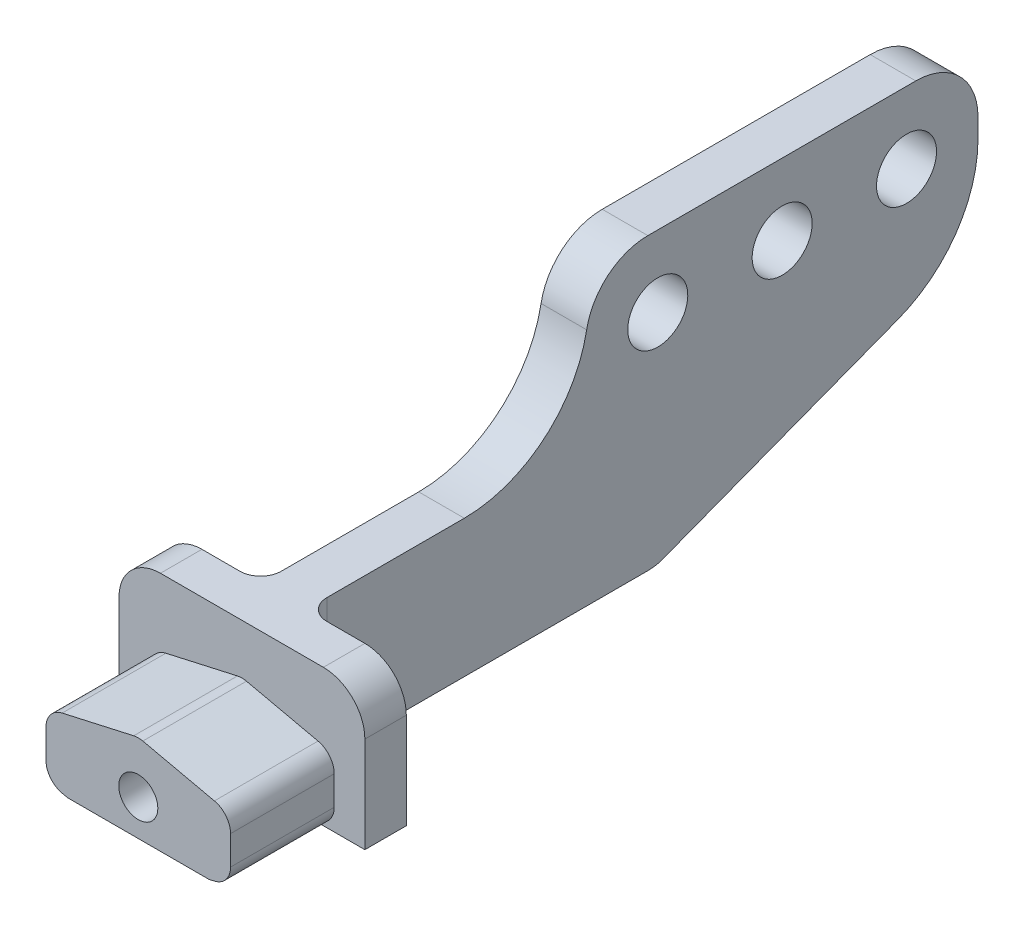
from build123d import *

# Parameters (mm, degrees)
SKETCH3_W                      = 5.93
SKETCH3_H                      = 4.886
MOUNT_BASE_PLATE_DEPTH         = 1
HORN_LEVER_PROFILE_W           = 1.1
HORN_LEVER_PROFILE_H           = 7
LEVER_PROFILE_DEPTH            = 16.204
LOWER_CH_FRONT_DIVOT_W         = 6.814
LOWER_CH_FRONT_DIVOT_H         = 3.69
FRONT_BASE_PROFILE_CUT_DEPTH   = 19.667421273
REAR_PROFILE_CUT_DEPTH         = 19.667421273
F_3_HOLES_R                    = 0.7239
F_3_HOLES_CIUT_DEPTH           = 19.667421273
THRU_BASE_MOUNT_TAB_DEPTH      = 2.5
SKETCH9_R                      = 0.47117
THRU_BASE_MOUNT_TAB_HOLE_DEPTH = 4
BASE_PLATE_CORNER_FILLET_R     = 1
FRONT_LEVER_UNDER_FILLET_R     = 3
FRONT_LEVER_TOP_FILLETS_R      = 1.5
REAR_TOP_FILLET_R              = 3
SIDE_BASE_LEVER_ARM_FILLETS_R  = 0.5
THRU_BASE_MOUNT_TAB_FILLETS_R  = 0.5
BOT_MIIDLEVER_ANGLE_FILLET_R   = 1


with BuildPart() as part:
    # Sketch3 → Mount Base Plate (new body)
    with BuildSketch(Plane.XY):
        with Locations((0, 2.443)):
            Rectangle(SKETCH3_W, SKETCH3_H)
    extrude(amount=MOUNT_BASE_PLATE_DEPTH)

    # Horn Lever Profile → Lever Profile (add)
    with BuildSketch(Plane.XY):
        with Locations((0, 5.076)):
            Rectangle(HORN_LEVER_PROFILE_W, HORN_LEVER_PROFILE_H)
    extrude(amount=-LEVER_PROFILE_DEPTH)

    # Lower CH Front Divot → Front Base Profile Cut (cut, through all)
    with BuildSketch(Plane(origin=(0.55, 0, 0), x_dir=(0, 0, -1), z_dir=(1, 0, 0))):
        with Locations((3.407, 6.731)):
            Rectangle(LOWER_CH_FRONT_DIVOT_W, LOWER_CH_FRONT_DIVOT_H)
    extrude(amount=-FRONT_BASE_PROFILE_CUT_DEPTH, mode=Mode.SUBTRACT)

    # Sketch6 → Rear Profile Cut (cut, through all)
    with BuildSketch(Plane(origin=(0.55, 0, 0), x_dir=(0, 0, -1), z_dir=(1, 0, 0))):
        Polygon((8.434, 1.576), (16.204, 4.547737021), (16.204, 1.576), align=None)
    extrude(amount=-REAR_PROFILE_CUT_DEPTH, mode=Mode.SUBTRACT)

    # 3 Holes → 3 Holes Ciut (cut, through all)
    with BuildSketch(Plane(origin=(0.55, 0, 0), x_dir=(0, 0, -1), z_dir=(1, 0, 0))):
        with Locations(Location((14.4801, 6.8521, 0), (0, 0, 90))):
            Circle(F_3_HOLES_R)
        with Locations(Location((11.4801, 6.8521, 0), (0, 0, 90))):
            Circle(F_3_HOLES_R)
        with Locations(Location((8.4801, 6.8521, 0), (0, 0, 90))):
            Circle(F_3_HOLES_R)
    extrude(amount=-F_3_HOLES_CIUT_DEPTH, mode=Mode.SUBTRACT)

    # Thru Surface Base Ext → Thru Base Mount Tab (add)
    with BuildSketch(Plane.XY.offset(1)):
        Polygon((0, 3.693), (2.226, 3.193), (2.226, 1.693), (0, 1.193), (-2.226, 1.693), (-2.226, 3.193), align=None)
    extrude(amount=THRU_BASE_MOUNT_TAB_DEPTH)

    # Sketch9 → Thru Base Mount Tab Hole (cut)
    with BuildSketch(Plane.XY.offset(3.5)):
        with Locations((0, 2.443)):
            Circle(SKETCH9_R)
    extrude(amount=-THRU_BASE_MOUNT_TAB_HOLE_DEPTH, mode=Mode.SUBTRACT)

    # Base Plate Corner Fillet
    base_plate_corner_fillet_edges = [part.edges().sort_by_distance(p)[0] for p in [
        (-2.965, 4.886, 0.5),
        (2.965, 4.886, 0.5),
        (2.965, 0, 0.5),
        (-2.965, 0, 0.5),
    ]]
    fillet(base_plate_corner_fillet_edges, radius=BASE_PLATE_CORNER_FILLET_R)

    # Front Lever Under Fillet
    front_lever_under_fillet_edges = [part.edges().sort_by_distance(p)[0] for p in [
        (0, 4.886, -6.814),
    ]]
    fillet(front_lever_under_fillet_edges, radius=FRONT_LEVER_UNDER_FILLET_R)

    # Front Lever Top Fillets
    # the kernel refuses this fillet: 1.5 mm, written as the material it takes off along each edge
    with BuildSketch(Plane(origin=(4.3, 8.576, -16.204), x_dir=(0, 0, 1), z_dir=(-1, 0, 0))) as front_lever_top_fillets_piece_1:
        with BuildLine():
            CenterArc((FRONT_LEVER_TOP_FILLETS_R, -FRONT_LEVER_TOP_FILLETS_R), FRONT_LEVER_TOP_FILLETS_R, 90, 90)
            Line((0, -FRONT_LEVER_TOP_FILLETS_R), (0, 0))
            Line((0, 0), (FRONT_LEVER_TOP_FILLETS_R, 0))
        make_face()
    extrude(amount=8.6, mode=Mode.SUBTRACT)
    with BuildSketch(Plane(origin=(4.116249365, 8.576, -6.814), x_dir=(0, -0.9992074286085749, 0.03980596203384177), z_dir=(-1, 0, 0))) as front_lever_top_fillets_piece_2:
        with BuildLine():
            CenterArc((1.442027948, -1.485078086), FRONT_LEVER_TOP_FILLETS_R, 98.088443448, 79.630240195)
            Line((-0.056783195, -1.425369143), (-0.206664309, -1.419398249))
            Line((-0.206664309, -1.419398249), (-0.149881114, 0.005970894))
            Line((-0.149881114, 0.005970894), (0.005970894, 0.149881114))
            ThreePointArc((0.005970894, 0.149881114), (0.69542402, 0.122415), (1.209870405, 0.148507809))
            Line((1.209870405, 0.148507809), (1.230975636, 0))
        make_face()
    extrude(amount=8.232498729, mode=Mode.SUBTRACT)

    # Rear Top Fillet
    rear_top_fillet_edges = [part.edges().sort_by_distance(p)[0] for p in [
        (0, 4.547737021, -16.204),
    ]]
    fillet(rear_top_fillet_edges, radius=REAR_TOP_FILLET_R)

    # Side Base Lever Arm Fillets
    side_base_lever_arm_fillets_edges = [part.edges().sort_by_distance(p)[0] for p in [
        (-0.55, 3.231, 0),
        (0.55, 3.231, 0),
    ]]
    fillet(side_base_lever_arm_fillets_edges, radius=SIDE_BASE_LEVER_ARM_FILLETS_R)

    # Thru base Mount Tab Fillets
    thru_base_mount_tab_fillets_edges = [part.edges().sort_by_distance(p)[0] for p in [
        (0, 3.693, 2.25),
        (-2.226, 3.193, 2.25),
        (-2.226, 1.693, 2.25),
        (0, 1.193, 2.25),
        (2.226, 1.693, 2.25),
        (2.226, 3.193, 2.25),
    ]]
    fillet(thru_base_mount_tab_fillets_edges, radius=THRU_BASE_MOUNT_TAB_FILLETS_R)

    # Bot MiidLever Angle Fillet
    bot_miidlever_angle_fillet_edges = [part.edges().sort_by_distance(p)[0] for p in [
        (0, 1.576, -8.434),
    ]]
    fillet(bot_miidlever_angle_fillet_edges, radius=BOT_MIIDLEVER_ANGLE_FILLET_R)

    # SurfaceCut1
    split(bisect_by=Plane.XZ.offset(-1.576), keep=Keep.BOTTOM)


solid = part.part
